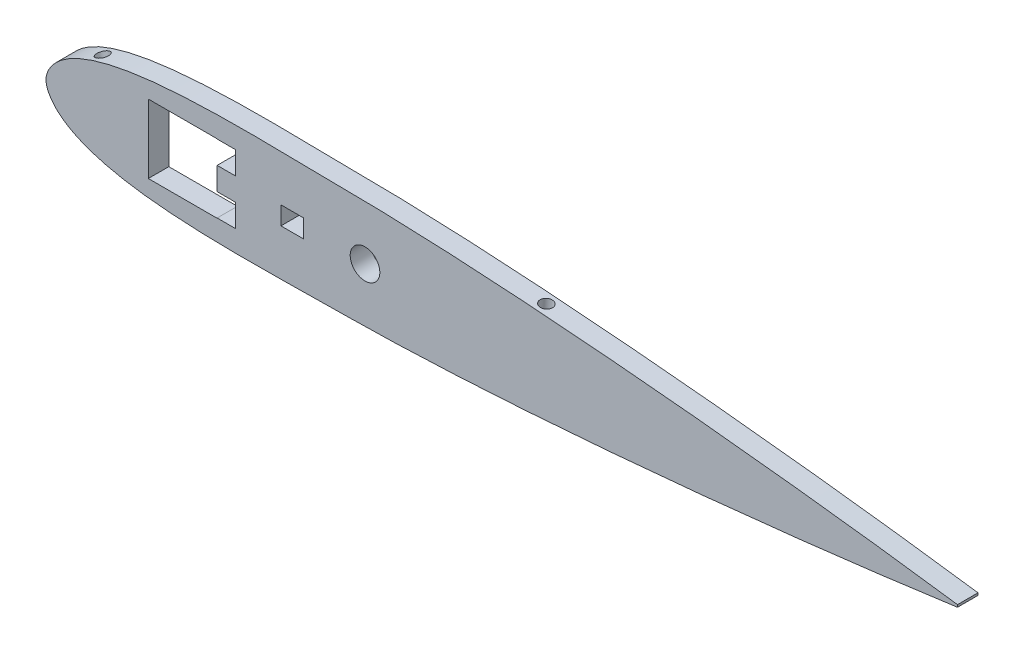
from build123d import *

# Parameters (mm, degrees)
BOSS_EXTRUDE2_DEPTH = 5.715
SKETCH4_W           = 19.177
SKETCH4_H           = 19.177
CUT_EXTRUDE1_DEPTH  = 255.536326803
SKETCH9_R           = 4.1275
CUT_EXTRUDE2_DEPTH  = 255.536326803
SKETCH10_W          = 6.35
SKETCH10_H          = 5.08
SKETCH10_W_2        = 5.08
SKETCH10_H_2        = 6.35
CUT_EXTRUDE3_DEPTH  = 255.536326803


# Read off the part's stored shape, not the designer's step: Mirror1
with BuildPart() as part:
    # Sketch2 → Boss-Extrude2 (new body)
    with BuildSketch(Plane.XY):
        with BuildLine():
            Line((254, 0.32004), (254, -0.32004))
            add(Edge.make_bspline(
                [(254, 0.32004), (249.767631422, 0.903839201), (241.307291179, 2.070831107), (228.605373144, 3.690750774), (215.905231222, 5.229453163), (203.204539078, 6.675530537), (190.504313454, 8.039878015), (177.804260451, 9.32064365), (165.104460348, 10.514392622), (152.404191083, 11.606339724), (139.704381633, 12.598267516), (126.919607049, 13.472959141), (114.13521526, 14.221481743), (101.349465964, 14.775693136), (88.648632088, 15.185192204), (78.146386791, 15.178035247), (69.765668809, 15.373203718), (63.500254506, 15.460449009), (57.150055086, 15.506323834), (50.799339255, 15.478252184), (44.447830212, 15.346475062), (38.094548208, 15.078267108), (31.738441392, 14.620088359), (25.803106345, 13.959353637), (20.288821299, 13.055179709), (16.052048681, 12.090997742), (12.675404003, 11.07010546), (10.119694898, 10.136024937), (7.548966852, 8.96473462), (4.932712272, 7.430004121), (2.762461508, 5.635138845), (0.8510933, 3.232632286), (-0.555766099, 0), (0.8510933, -3.232632286), (2.762461508, -5.635138845), (4.932712272, -7.430004121), (7.548966852, -8.96473462), (10.119694898, -10.136024937), (12.675404003, -11.07010546), (16.052048681, -12.090997742), (20.288821299, -13.055179709), (25.803106345, -13.959353637), (31.738441392, -14.620088359), (38.094548208, -15.078267108), (44.447830212, -15.346475062), (50.799339255, -15.478252184), (57.150055086, -15.506323834), (63.500254506, -15.460449009), (69.765668809, -15.373203718), (78.146386791, -15.178035247), (88.648632088, -15.185192204), (101.349465964, -14.775693136), (114.13521526, -14.221481743), (126.919607049, -13.472959141), (139.704381633, -12.598267516), (152.404191083, -11.606339724), (165.104460348, -10.514392622), (177.804260451, -9.32064365), (190.504313454, -8.039878015), (203.204539078, -6.675530537), (215.905231222, -5.229453163), (228.605373144, -3.690750774), (241.307291179, -2.070831107), (249.767631422, -0.903839201), (254, -0.32004)],
                knots=[0, 0, 0, 0, 0.024634231, 0.04924287, 0.07382978, 0.098396751, 0.122945996, 0.147478562, 0.171994581, 0.196493552, 0.220976186, 0.245442093, 0.270380478, 0.294812969, 0.319231823, 0.343641967, 0.355360378, 0.36756608, 0.379770767, 0.391975369, 0.404182653, 0.416398684, 0.428636132, 0.440920171, 0.450818129, 0.460843203, 0.465945571, 0.471149096, 0.476522598, 0.482208155, 0.488618357, 0.492567758, 0.5, 0.507432242, 0.511381643, 0.517791845, 0.523477402, 0.528850904, 0.534054429, 0.539156797, 0.549181871, 0.559079829, 0.571363868, 0.583601316, 0.595817347, 0.608024631, 0.620229233, 0.63243392, 0.644639622, 0.656358033, 0.680768177, 0.705187031, 0.729619522, 0.754557907, 0.779023814, 0.803506448, 0.828005419, 0.852521438, 0.877054004, 0.901603249, 0.92617022, 0.95075713, 0.975365769, 1, 1, 1, 1], degree=3))
        make_face()
    extrude(amount=BOSS_EXTRUDE2_DEPTH)

    # Sketch4 → Cut-Extrude1 (cut, through all)
    with BuildSketch(Plane(origin=(0, 0, 0), x_dir=(-1, 0, 0), z_dir=(0, 0, -1))):
        with Locations((-38.1, 0)):
            Rectangle(SKETCH4_W, SKETCH4_H)
    extrude(amount=-CUT_EXTRUDE1_DEPTH, mode=Mode.SUBTRACT)

    # Sketch8 → Tap Drill for #8-32 Tap1 (revolve, cut)
    with BuildSketch(Plane(origin=(136.57299856, -12.803424887, 2.8575), x_dir=(0.9974981573794872, 0.07069247502052767, 0), z_dir=(0, 0, 1))):
        Polygon((0, 0), (0, 7.387806461), (1.7272, 6.35), (1.7272, 0), align=None)
    revolve(axis=Axis((137.021895776, -19.137538186, 2.8575), (-0.07069247502052767, 0.9974981573794872, 0)), mode=Mode.SUBTRACT)

    # Sketch8 at point 2 (carried to point 2, square into its face) → Tap Drill for #8-32 Tap1 at 2 (revolve, cut)
    with BuildSketch(Plane(origin=(12.942329602, -11.131586712, 2.8575), x_dir=(0.950373623, -0.311110876, 0), z_dir=(0, 0, 1))):
        Polygon((0, 0), (0, 7.387806461), (1.7272, 6.35), (1.7272, 0), align=None)
    revolve(axis=Axis((10.966775537, -17.166459215, 2.8575), (0.311110876, 0.950373623, 0)), mode=Mode.SUBTRACT)

    # Mirror1 outline → Mirror1 (revolve, cut)
    with BuildSketch(Plane(origin=(14.980935799, 4.904108289, 2.8575), x_dir=(0.9503735615511663, 0.31111106297358115, 0), z_dir=(0, 0, -1))):
        Polygon((1.7272, -6.552668082), (1.7272, -0.202663789), (0, 0.835142672), (0, -6.552668082), align=None)
    revolve(axis=Axis((14.980935799, 4.904108289, 2.8575), (0.31111106297358115, -0.9503735615511663, 0)), mode=Mode.SUBTRACT)

    # Mirror1 2 outline → Mirror1 2 (revolve, cut)
    with BuildSketch(Plane(origin=(134.987643741, -9.566544622, 2.8575), x_dir=(0.9974981573794872, -0.07069247502052772, 0), z_dir=(0, 0, 1))):
        Polygon((0, 15.038269561), (1.7272, 16.076076022), (1.7272, 22.426076022), (0, 22.426076022), align=None)
    revolve(axis=Axis((134.987643741, -9.566544622, 2.8575), (0.07069247502052774, 0.9974981573794874, 0)), mode=Mode.SUBTRACT)

    # Sketch9 → Cut-Extrude2 (cut, through all)
    with BuildSketch(Plane.XY):
        with Locations((88.9, 0)):
            Circle(SKETCH9_R)
    extrude(amount=CUT_EXTRUDE2_DEPTH, mode=Mode.SUBTRACT)

    # Sketch10 → Cut-Extrude3 (cut, through all)
    with BuildSketch(Plane(origin=(0, 0, 0), x_dir=(-1, 0, 0), z_dir=(0, 0, -1))):
        with Locations((-68.6435, 0)):
            Rectangle(SKETCH10_W, SKETCH10_H)
        with Locations((-50.2285, 6.35)):
            Rectangle(SKETCH10_W_2, SKETCH10_H_2)
        with Locations((-50.2285, -6.35)):
            Rectangle(SKETCH10_W_2, SKETCH10_H_2)
    extrude(amount=-CUT_EXTRUDE3_DEPTH, mode=Mode.SUBTRACT)


solid = part.part
